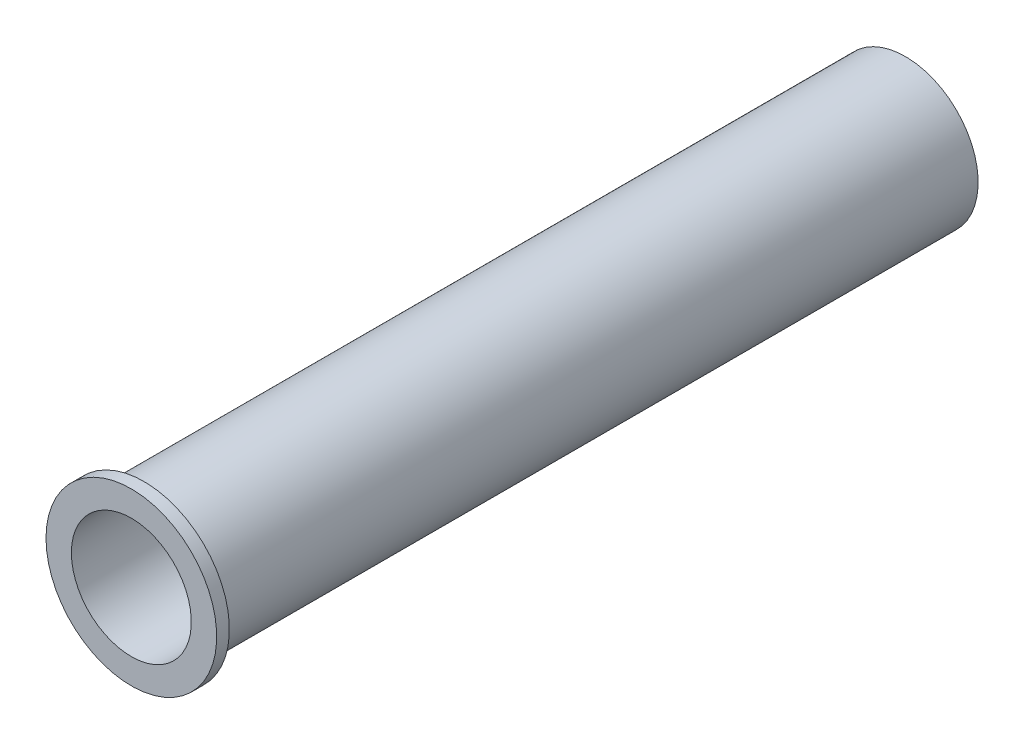
from build123d import *


with BuildPart() as part:
    # Croquis1 → Revolución1 (revolve)
    with BuildSketch(Plane.YZ):
        Polygon((9.45, -60), (9.45, 60), (13.45, 60), (13.45, 58), (11.45, 58), (11.45, -62), (7.95, -62), (7.95, -60), align=None)
    revolve(axis=Axis((0, 0, 0), (0, 0, 1)))


solid = part.part
